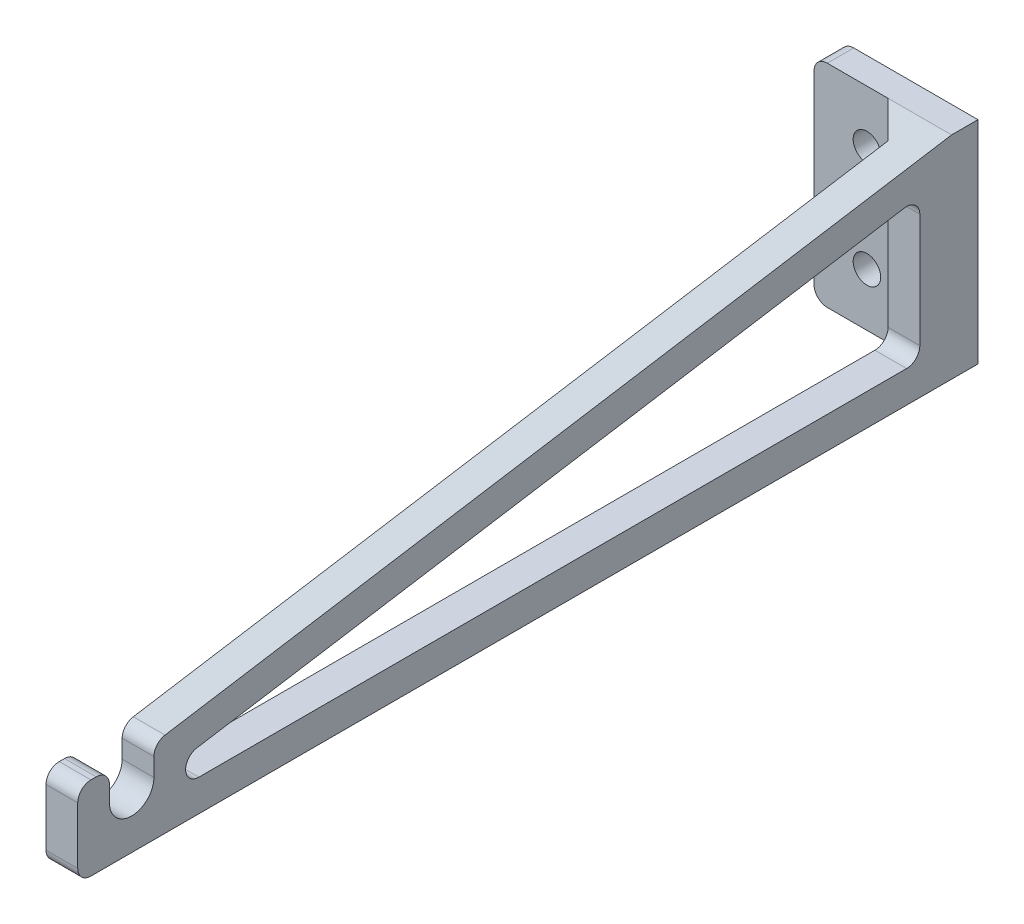
from build123d import *

# Parameters (mm, degrees)
SKETCH_1_W          = 20
SKETCH_1_H          = 40
EXTRUDE_1_DEPTH     = 5
EXTRUDE_2_DEPTH     = 6
SKETCH_3_R          = 2.6
CUT_EXTRUDE_1_DEPTH = 172.146253246
FILLET_1_R          = 2.5
CHAMFER_2_SIZE      = 6
SKETCH_5_R          = 5
CUT_EXTRUDE_2_DEPTH = 172.146253246


with BuildPart() as part:
    # Эскиз1 → Бобышка-Вытянуть1 (new body)
    with BuildSketch(Plane.XY):
        with Locations((10, 20)):
            Rectangle(SKETCH_1_W, SKETCH_1_H)
    extrude(amount=EXTRUDE_1_DEPTH)

    # Эскиз2 → Бобышка-Вытянуть2 (add)
    with BuildSketch(Plane.ZY):
        with BuildLine():
            Line((5, 40), (0, 40))
            Line((0, 40), (0, 0))
            Line((0, 0), (170.2, 0))
            Line((170.2, 0), (170.2, 15.750753769))
            Line((170.2, 15.750753769), (164.2, 15.750753769))
            Line((164.2, 15.750753769), (164.2, 10.2))
            ThreePointArc((164.2, 10.2), (160, 6), (155.8, 10.2))
            Line((155.8, 10.2), (155.8, 15.750753769))
            Line((155.8, 15.750753769), (5, 40))
        make_face()
        Polygon((11, 6), (149.8, 6), (149.8, 10.638499185), (11, 32.958097175), align=None, mode=Mode.SUBTRACT)
    extrude(amount=EXTRUDE_2_DEPTH)

    # Эскиз3 → Вырез-Вытянуть1 (cut, through all)
    with BuildSketch(Plane.XY.offset(5)):
        with Locations((10, 30)):
            Circle(SKETCH_3_R)
        with Locations((10, 10)):
            Circle(SKETCH_3_R)
    extrude(amount=-CUT_EXTRUDE_1_DEPTH, mode=Mode.SUBTRACT)

    # Скругление1
    fillet_1_edges = [part.edges().sort_by_distance(p)[0] for p in [
        (20, 0, 2.5),
        (-3, 0, 170.2),
        (20, 40, 2.5),
        (-3, 15.750753769, 170.2),
        (-3, 15.750753769, 164.2),
        (-3, 15.750753769, 155.8),
        (-3, 32.958097175, 11),
        (-3, 6, 11),
        (-3, 10.638499185, 149.8),
        (-3, 6, 149.8),
    ]]
    fillet(fillet_1_edges, radius=FILLET_1_R)

    # Фаска2
    chamfer_2_edges = [part.edges().sort_by_distance(p)[0] for p in [
        (0, 20, 5),
    ]]
    chamfer(chamfer_2_edges, length=CHAMFER_2_SIZE - 0.0001)  # a hair under: the kernel refuses the full size

    # Эскиз5 → Вырез-Вытянуть2 (cut, through all)
    with BuildSketch(Plane.XY.offset(5)):
        with Locations((10, 10)):
            Circle(SKETCH_5_R)
        with Locations((10, 30)):
            Circle(SKETCH_5_R)
    extrude(amount=CUT_EXTRUDE_2_DEPTH, mode=Mode.SUBTRACT)


with BuildPart() as body_2:
    # Зеркальное отражение1: mirrored copy
    add(part.part.mirror(Plane(origin=(0, 0, 0), x_dir=(0, 0, 1), z_dir=(1, 0, 0))))


solid = body_2.part
